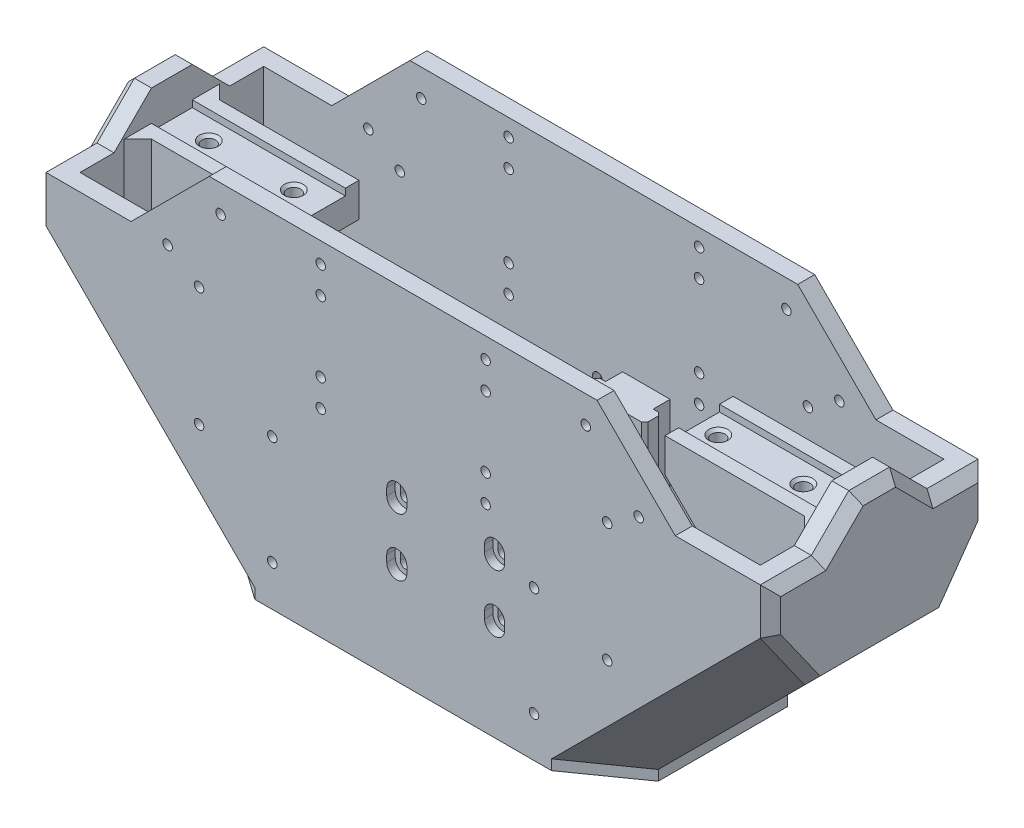
from build123d import *

# Parameters (mm, degrees)
SKETCH1_W                  = 200
SKETCH1_H                  = 54
BOSS_EXTRUDE1_DEPTH        = 70
SHELL1_T                   = 5
BOSS_EXTRUDE2_DEPTH        = 5
BOSS_EXTRUDE3_DEPTH        = 5
SKETCH3_R                  = 1.4
CUT_EXTRUDE1_DEPTH         = 6
BOSS_EXTRUDE4_DEPTH        = 10
SKETCH9_W                  = 45
SKETCH9_H                  = 20
BOSS_EXTRUDE6_DEPTH        = 2
CUT_EXTRUDE2_REACH         = 229.372
SKETCH10_W                 = 12
SKETCH10_H                 = 2
CHAMFER3_SIZE              = 40
CHAMFER5_SIZE              = 43
CHAMFER11_SIZE             = 10
CHAMFER12_SIZE             = 13
CHAMFER13_SIZE             = 4
BOSS_EXTRUDE10_DEPTH       = 3
CHAMFER14_SIZE             = 3
CHAMFER14_OF_MIRROR28_SIZE = 3
SKETCH17_W                 = 14
SKETCH17_H                 = 5
BOSS_EXTRUDE11_DEPTH       = 45
SKETCH20_W                 = 19
SKETCH20_H                 = 5
BOSS_EXTRUDE14_DEPTH       = 8
CUT_EXTRUDE4_DEPTH         = 2.5
CUT_EXTRUDE5_REACH         = 157.226
CUT_EXTRUDE6_REACH         = 189.609
SKETCH24_W                 = 15
SKETCH24_H                 = 8
CHAMFER18_SIZE             = 4
CHAMFER19_SIZE             = 1
CHAMFER20_SIZE             = 2
BOSS_EXTRUDE15_DEPTH       = 3
CUT_EXTRUDE7_REACH         = 148.072
SKETCH27_W                 = 60
SKETCH27_H                 = 24
CHAMFER21_SIZE             = 5
SKETCH28_R                 = 2.75
CUT_EXTRUDE8_DEPTH         = 7
SKETCH29_R                 = 2.75
CUT_EXTRUDE9_DEPTH         = 7
MIRROR33_COPY_1_SKETCH_R   = 2.75
MIRROR33_COPY_1_DEPTH      = 7
SKETCH32_R                 = 1.9
CUT_EXTRUDE11_DEPTH        = 2
MIRROR35_COPY_1_SKETCH_R   = 1.9
MIRROR35_COPY_1_DEPTH      = 2
SKETCH33_R                 = 2
CUT_EXTRUDE12_DEPTH        = 5.2
SKETCH34_R                 = 2
CUT_EXTRUDE13_DEPTH        = 5.2
SKETCH35_R                 = 1.4
CUT_EXTRUDE14_DEPTH        = 6
LPATTERN1_COUNT            = 2
LPATTERN1_PITCH            = 8
CUT_EXTRUDE15_REACH        = 158.234
SKETCH36_R                 = 1.4
LPATTERN2_COUNT            = 2
LPATTERN2_PITCH            = 8
CUT_EXTRUDE16_REACH        = 158.234
SKETCH39_R                 = 1.4
CUT_EXTRUDE17_REACH        = 158.234
SKETCH40_R                 = 1.4
CUT_EXTRUDE18_REACH        = 158.234
SKETCH41_R                 = 1.4
MIRROR38_COPY_1_REACH      = 158.234
MIRROR38_COPY_1_SKETCH_R   = 1.4
CUT_EXTRUDE19_REACH        = 194.48
SKETCH43_R                 = 1.4
CHAMFER22_SIZE             = 0.8
CHAMFER23_SIZE             = 1


# Some blends are built 0.0001 mm under size
with BuildPart() as part:
    # Sketch1 → Boss-Extrude1 (new body)
    with BuildSketch(Plane(origin=(0, 0, 0), x_dir=(1, 0, 0), z_dir=(0, 1, 0))):
        Rectangle(SKETCH1_W, SKETCH1_H)
    extrude(amount=BOSS_EXTRUDE1_DEPTH)

    # Shell1
    shell1_openings = [part.faces().sort_by_distance(p)[0] for p in [
        (0, 70, 0),
    ]]
    offset(amount=SHELL1_T, openings=shell1_openings, kind=Kind.INTERSECTION)

    # Sketch2 → Boss-Extrude2 (add)
    with BuildSketch(Plane(origin=(105, 0, 0), x_dir=(0, 0, -1), z_dir=(1, 0, 0))):
        Polygon((-17, 70), (-6, 81), (6, 81), (17, 70), align=None)
    boss_extrude2 = extrude(amount=-BOSS_EXTRUDE2_DEPTH)

    # Sketch4 → Boss-Extrude3 (add)
    with BuildSketch(Plane(origin=(0, 0, -32), x_dir=(-1, 0, 0), z_dir=(0, 0, -1))):
        Polygon((-80, 70), (-57, 93), (57, 93), (80, 70), align=None)
    boss_extrude3 = extrude(amount=-BOSS_EXTRUDE3_DEPTH)

    # Sketch3 → Cut-Extrude1 (cut)
    with BuildSketch(Plane(origin=(0, 0, -32), x_dir=(-1, 0, 0), z_dir=(0, 0, -1))):
        with Locations((-28, 88)):
            Circle(SKETCH3_R)
        with Locations((-28, 56)):
            Circle(SKETCH3_R)
        with Locations((28, 88)):
            Circle(SKETCH3_R)
        with Locations((28, 56)):
            Circle(SKETCH3_R)
    cut_extrude1 = extrude(amount=-CUT_EXTRUDE1_DEPTH, mode=Mode.SUBTRACT)

    # Mirror4: Boss-Extrude3 across plane
    add(boss_extrude3.mirror(Plane.XY))

    # Mirror5: Boss-Extrude2 across plane
    add(boss_extrude2.mirror(Plane(origin=(0, 0, 0), x_dir=(0, 0, 1), z_dir=(1, 0, 0))))

    # Sketch5 → Boss-Extrude4 (add, symmetric)
    with BuildSketch(Plane.XY):
        Polygon((-100, 70), (-55, 70), (-55, 62), (-100, 17), align=None)
    boss_extrude4 = extrude(amount=BOSS_EXTRUDE4_DEPTH, both=True)

    # Sketch9 → Boss-Extrude6 (add)
    with BuildSketch(Plane(origin=(0, 70, 0), x_dir=(1, 0, 0), z_dir=(0, 1, 0))):
        with Locations((-77.5, 0)):
            Rectangle(SKETCH9_W, SKETCH9_H)
    boss_extrude6 = extrude(amount=BOSS_EXTRUDE6_DEPTH)

    # Sketch10 → Cut-Extrude2 (cut, up to next)
    with BuildSketch(Plane(origin=(-100, 0, 0), x_dir=(0, 0, -1), z_dir=(1, 0, 0)), mode=Mode.PRIVATE) as cut_extrude2_sk1:
        with Locations((0, 71)):
            Rectangle(SKETCH10_W, SKETCH10_H)
    cut_extrude2_tool1 = extrude(cut_extrude2_sk1.sketch, amount=CUT_EXTRUDE2_REACH, mode=Mode.PRIVATE) & part.part
    cut_extrude2 = cut_extrude2_tool1.solids().sort_by_distance((-100, 71, 0))[0]
    add(cut_extrude2, mode=Mode.SUBTRACT)

    # Mirror24: Boss-Extrude4, Boss-Extrude6, Cut-Extrude2 across plane
    add(boss_extrude4.mirror(Plane(origin=(0, 0, 0), x_dir=(0, 0, 1), z_dir=(1, 0, 0))))
    add(boss_extrude6.mirror(Plane(origin=(0, 0, 0), x_dir=(0, 0, 1), z_dir=(1, 0, 0))))
    add(cut_extrude2.mirror(Plane(origin=(0, 0, 0), x_dir=(0, 0, 1), z_dir=(1, 0, 0))), mode=Mode.SUBTRACT)

    # Chamfer3
    # the kernel refuses this chamfer: 40 mm, written as the material it adds along each edge
    with BuildSketch(Plane(origin=(100, 0, 27), x_dir=(0.027495876610586317, 0.9996219169112968, 0), z_dir=(0, 0, -1)), Plane(origin=(-100, 0, -27), x_dir=(-0.027495876610586317, 0.9996219169112968, 0), z_dir=(0, 0, 1))) as chamfer3_piece_1:
        Polygon((CHAMFER3_SIZE * 0.999621916911, -CHAMFER3_SIZE * 0.0274958766106), (-CHAMFER3_SIZE * 0.0274958766106, -CHAMFER3_SIZE * 0.999621916911), (0, 0), align=None)
    extrude(amount=54)

    # Chamfer5
    chamfer5_edges = [part.edges().sort_by_distance(p)[0] for p in [
        (-105, -5, 0),
        (105, -5, 0),
    ]]
    chamfer(chamfer5_edges, length=CHAMFER5_SIZE)

    # Chamfer11
    chamfer11_edges = [part.edges().sort_by_distance(p)[0] for p in [
        (-80, 20, -27),
        (80, 20, -27),
        (-80, 20, 27),
        (80, 20, 27),
    ]]
    chamfer(chamfer11_edges, length=CHAMFER11_SIZE)

    # Chamfer12
    chamfer12_edges = [part.edges().sort_by_distance(p)[0] for p in [
        (-83.5, 16.5, -32),
        (83.5, 16.5, -32),
        (-83.5, 16.5, 32),
        (83.5, 16.5, 32),
    ]]
    chamfer(chamfer12_edges, length=CHAMFER12_SIZE)

    # Chamfer13
    chamfer13_edges = [part.edges().sort_by_distance(p)[0] for p in [
        (-100, 56, -10),
        (-100, 56, 10),
        (100, 56, 10),
        (100, 56, -10),
    ]]
    chamfer(chamfer13_edges, length=CHAMFER13_SIZE)

    # Sketch16 → Boss-Extrude10 (add)
    with BuildSketch(Plane(origin=(105, 0, 0), x_dir=(0, 0, -1), z_dir=(1, 0, 0))):
        Polygon((-19, 38), (19, 38), (32, 56.384776311), (32, 70), (17, 70), (6, 81), (-6, 81), (-17, 70), (-32, 70), (-32, 56.384776311), align=None)
    boss_extrude10 = extrude(amount=BOSS_EXTRUDE10_DEPTH)

    # Chamfer14
    chamfer14_edges = [part.edges().sort_by_distance(p)[0] for p in [
        (108, 63.192388155, 32),
        (108, 70, 24.5),
        (108, 75.5, 11.5),
        (108, 81, 0),
        (108, 75.5, -11.5),
        (108, 70, -24.5),
        (108, 63.192388155, -32),
        (108, 47.192388155, -25.5),
        (108, 38, 0),
        (108, 47.192388155, 25.5),
    ]]
    chamfer(chamfer14_edges, length=CHAMFER14_SIZE - 0.0001)  # a hair under: the kernel refuses the full size

    # Mirror28: Boss-Extrude10 across plane
    add(boss_extrude10.mirror(Plane(origin=(0, 0, 0), x_dir=(0, 0, 1), z_dir=(1, 0, 0))))

    # Chamfer14 of Mirror28
    chamfer14_of_mirror28_edges = [part.edges().sort_by_distance(p)[0] for p in [
        (-108, 63.192388155, 32),
        (-108, 70, 24.5),
        (-108, 75.5, 11.5),
        (-108, 81, 0),
        (-108, 75.5, -11.5),
        (-108, 70, -24.5),
        (-108, 63.192388155, -32),
        (-108, 47.192388155, -25.5),
        (-108, 38, 0),
        (-108, 47.192388155, 25.5),
    ]]
    chamfer(chamfer14_of_mirror28_edges, length=CHAMFER14_OF_MIRROR28_SIZE - 0.0001)  # a hair under: the kernel refuses the full size

    # Sketch17 → Boss-Extrude11 (add)
    with BuildSketch(Plane(origin=(0, 0, 0), x_dir=(1, 0, 0), z_dir=(0, 1, 0))):
        Polygon((3, -22), (5.5, -22), (19.5, -22), (22, -22), (22, -17), (3, -17), align=None)
        with Locations((12.5, -24.5)):
            Rectangle(SKETCH17_W, SKETCH17_H)
    boss_extrude11 = extrude(amount=BOSS_EXTRUDE11_DEPTH)

    # Sketch20 → Boss-Extrude14 (add)
    with BuildSketch(Plane(origin=(0, 0, 0), x_dir=(1, 0, 0), z_dir=(0, 1, 0))):
        with Locations((12.5, -14.5)):
            Rectangle(SKETCH20_W, SKETCH20_H)
    boss_extrude14 = extrude(amount=BOSS_EXTRUDE14_DEPTH)

    # Mirror29: Boss-Extrude11, Boss-Extrude14 across plane
    add(boss_extrude11.mirror(Plane.XY))
    add(boss_extrude14.mirror(Plane.XY))

    # Sketch22 → Cut-Extrude4 (cut)
    with BuildSketch(Plane.XY.offset(-27)):
        with BuildLine():
            Line((-3.325, 37.8), (-3.325, 39.8))
            ThreePointArc((-3.325, 39.8), (-1.875, 41.25), (-0.425, 39.8))
            Line((-0.425, 39.8), (-0.425, 37.8))
            ThreePointArc((-0.425, 37.8), (-1.875, 36.35), (-3.325, 37.8))
        make_face()
        with BuildLine():
            Line((28.325, 37.8), (28.325, 39.8))
            ThreePointArc((28.325, 39.8), (26.875, 41.25), (25.425, 39.8))
            Line((25.425, 39.8), (25.425, 37.8))
            ThreePointArc((25.425, 37.8), (26.875, 36.35), (28.325, 37.8))
        make_face()
        with BuildLine():
            Line((-3.325, 22.8), (-3.325, 20.8))
            ThreePointArc((-3.325, 20.8), (-1.875, 19.35), (-0.425, 20.8))
            Line((-0.425, 20.8), (-0.425, 22.8))
            ThreePointArc((-0.425, 22.8), (-1.875, 24.25), (-3.325, 22.8))
        make_face()
        with BuildLine():
            Line((28.325, 22.8), (28.325, 20.8))
            ThreePointArc((28.325, 20.8), (26.875, 19.35), (25.425, 20.8))
            Line((25.425, 20.8), (25.425, 22.8))
            ThreePointArc((25.425, 22.8), (26.875, 24.25), (28.325, 22.8))
        make_face()
    cut_extrude4 = extrude(amount=-CUT_EXTRUDE4_DEPTH, mode=Mode.SUBTRACT)

    # Sketch23 → Cut-Extrude5 (cut, up to next)
    with BuildSketch(Plane.XY.offset(-29.5), mode=Mode.PRIVATE) as cut_extrude5_sk1:
        with BuildLine():
            Line((29.825, 37.8), (29.825, 39.8))
            ThreePointArc((29.825, 39.8), (26.875, 42.75), (23.925, 39.8))
            Line((23.925, 39.8), (23.925, 37.8))
            ThreePointArc((23.925, 37.8), (26.875, 34.85), (29.825, 37.8))
        make_face()
    cut_extrude5_tool1 = extrude(cut_extrude5_sk1.sketch, amount=-CUT_EXTRUDE5_REACH, mode=Mode.PRIVATE) & part.part
    # Sketch23 → Cut-Extrude5 (cut, up to next)
    with BuildSketch(Plane.XY.offset(-29.5), mode=Mode.PRIVATE) as cut_extrude5_sk2:
        with BuildLine():
            Line((1.075, 37.8), (1.075, 39.8))
            ThreePointArc((1.075, 39.8), (-1.875, 42.75), (-4.825, 39.8))
            Line((-4.825, 39.8), (-4.825, 37.8))
            ThreePointArc((-4.825, 37.8), (-1.875, 34.85), (1.075, 37.8))
        make_face()
    cut_extrude5_tool2 = extrude(cut_extrude5_sk2.sketch, amount=-CUT_EXTRUDE5_REACH, mode=Mode.PRIVATE) & part.part
    # Sketch23 → Cut-Extrude5 (cut, up to next)
    with BuildSketch(Plane.XY.offset(-29.5), mode=Mode.PRIVATE) as cut_extrude5_sk3:
        with BuildLine():
            Line((-4.825, 22.8), (-4.825, 20.8))
            ThreePointArc((-4.825, 20.8), (-1.875, 17.85), (1.075, 20.8))
            Line((1.075, 20.8), (1.075, 22.8))
            ThreePointArc((1.075, 22.8), (-1.875, 25.75), (-4.825, 22.8))
        make_face()
    cut_extrude5_tool3 = extrude(cut_extrude5_sk3.sketch, amount=-CUT_EXTRUDE5_REACH, mode=Mode.PRIVATE) & part.part
    # Sketch23 → Cut-Extrude5 (cut, up to next)
    with BuildSketch(Plane.XY.offset(-29.5), mode=Mode.PRIVATE) as cut_extrude5_sk4:
        with BuildLine():
            Line((23.925, 22.8), (23.925, 20.8))
            ThreePointArc((23.925, 20.8), (26.875, 17.85), (29.825, 20.8))
            Line((29.825, 20.8), (29.825, 22.8))
            ThreePointArc((29.825, 22.8), (26.875, 25.75), (23.925, 22.8))
        make_face()
    cut_extrude5_tool4 = extrude(cut_extrude5_sk4.sketch, amount=-CUT_EXTRUDE5_REACH, mode=Mode.PRIVATE) & part.part
    cut_extrude5_1 = cut_extrude5_tool1.solids().sort_by_distance((26.875, 38.8, -29.5))[0]
    add(cut_extrude5_1, mode=Mode.SUBTRACT)
    cut_extrude5_2 = cut_extrude5_tool2.solids().sort_by_distance((-1.875, 38.8, -29.5))[0]
    add(cut_extrude5_2, mode=Mode.SUBTRACT)
    cut_extrude5_3 = cut_extrude5_tool3.solids().sort_by_distance((-1.875, 21.8, -29.5))[0]
    add(cut_extrude5_3, mode=Mode.SUBTRACT)
    cut_extrude5_4 = cut_extrude5_tool4.solids().sort_by_distance((26.875, 21.8, -29.5))[0]
    add(cut_extrude5_4, mode=Mode.SUBTRACT)
    cut_extrude5 = cut_extrude5_1 + cut_extrude5_2 + cut_extrude5_3 + cut_extrude5_4  # Cut-Extrude5 as one shape, for the pattern or mirror that repeats it

    # Mirror30: Cut-Extrude4, Cut-Extrude5 across plane
    add(cut_extrude4.mirror(Plane.XY), mode=Mode.SUBTRACT)
    add(cut_extrude5.mirror(Plane.XY), mode=Mode.SUBTRACT)

    # Sketch24 → Cut-Extrude6 (cut, up to next)
    with BuildSketch(Plane(origin=(30, -30, 0), x_dir=(0, 0, 1), z_dir=(-0.707106781186544, 0.7071067811865511, 0)), mode=Mode.PRIVATE) as cut_extrude6_sk1:
        with Locations((0, 51.426406871)):
            Rectangle(SKETCH24_W, SKETCH24_H)
    cut_extrude6_tool1 = extrude(cut_extrude6_sk1.sketch, amount=-CUT_EXTRUDE6_REACH, mode=Mode.PRIVATE) & part.part
    add(cut_extrude6_tool1.solids().sort_by_distance((66.363961, 6.363961, 0))[0], mode=Mode.SUBTRACT)

    # Chamfer18
    chamfer18_edges = [part.edges().sort_by_distance(p)[0] for p in [
        (22, 0, 17),
        (3, 0, 17),
        (3, 0, -17),
        (22, 0, -17),
    ]]
    chamfer(chamfer18_edges, length=CHAMFER18_SIZE)

    # Chamfer19
    chamfer19_edges = [part.edges().sort_by_distance(p)[0] for p in [
        (3, 24.5, 22),
        (22, 24.5, 22),
        (22, 26.5, 17),
        (3, 26.5, 17),
        (3, 24.5, -22),
        (3, 26.5, -17),
        (22, 26.5, -17),
        (22, 24.5, -22),
    ]]
    chamfer(chamfer19_edges, length=CHAMFER19_SIZE)

    # Chamfer20
    chamfer20_edges = [part.edges().sort_by_distance(p)[0] for p in [
        (70.942388155, 7.442388155, 7.5),
        (65.285533906, 1.785533906, 7.5),
        (65.285533906, 1.785533906, -7.5),
        (70.942388155, 7.442388155, -7.5),
    ]]
    chamfer(chamfer20_edges, length=CHAMFER20_SIZE)

    # Sketch25 → Boss-Extrude15 (add)
    with BuildSketch(Plane.XZ.offset(5)):
        Polygon((-43.615223689, -32), (43.615223689, -32), (62, -19), (62, 19), (43.615223689, 32), (-43.615223689, 32), (-62, 19), (-62, -19), align=None)
    extrude(amount=BOSS_EXTRUDE15_DEPTH)

    # Sketch27 → Cut-Extrude7 (cut, up to next)
    with BuildSketch(Plane(origin=(0, 0, 0), x_dir=(1, 0, 0), z_dir=(0, 1, 0)), mode=Mode.PRIVATE) as cut_extrude7_sk1:
        Rectangle(SKETCH27_W, SKETCH27_H)
    cut_extrude7_tool1 = extrude(cut_extrude7_sk1.sketch, amount=-CUT_EXTRUDE7_REACH, mode=Mode.PRIVATE) & part.part
    add(cut_extrude7_tool1.solids().sort_by_distance((0, 0, 0))[0], mode=Mode.SUBTRACT)

    # Chamfer21
    chamfer21_edges = [part.edges().sort_by_distance(p)[0] for p in [
        (-30, -4, 12),
        (-30, -4, -12),
        (30, -4, -12),
        (30, -4, 12),
    ]]
    chamfer(chamfer21_edges, length=CHAMFER21_SIZE)

    # Sketch28 → Cut-Extrude8 (cut)
    with BuildSketch(Plane.XZ.offset(8)):
        with Locations(Location((-52.807611845, 0, 0), (0, 0, 270))):
            Circle(SKETCH28_R)
        with Locations(Location((-52.807611845, 15, 0), (0, 0, 270))):
            Circle(SKETCH28_R)
        with Locations(Location((-52.807611845, -15, 0), (0, 0, 270))):
            Circle(SKETCH28_R)
    cut_extrude8 = extrude(amount=-CUT_EXTRUDE8_DEPTH, mode=Mode.SUBTRACT)

    # Mirror31: Cut-Extrude8 across plane
    add(cut_extrude8.mirror(Plane(origin=(0, 0, 0), x_dir=(0, 0, 1), z_dir=(1, 0, 0))), mode=Mode.SUBTRACT)

    # Sketch29 → Cut-Extrude9 (cut)
    with BuildSketch(Plane.XZ.offset(8)):
        with Locations(Location((0, 24, 0), (0, 0, 270))):
            Circle(SKETCH29_R)
        with Locations(Location((20, 24, 0), (0, 0, 270))):
            Circle(SKETCH29_R)
        with Locations(Location((40, 24, 0), (0, 0, 270))):
            Circle(SKETCH29_R)
    cut_extrude9 = extrude(amount=-CUT_EXTRUDE9_DEPTH, mode=Mode.SUBTRACT)

    # Mirror32: Cut-Extrude9 across plane
    add(cut_extrude9.mirror(Plane(origin=(0, 0, 0), x_dir=(0, 0, 1), z_dir=(1, 0, 0))), mode=Mode.SUBTRACT)

    # Mirror33: Cut-Extrude9 across plane
    add(cut_extrude9.mirror(Plane.XY), mode=Mode.SUBTRACT)

    # Mirror33 copy 1 sketch → Mirror33 copy 1 (cut)
    with BuildSketch(Plane(origin=(0, -8, 0), x_dir=(-1, 0, 0), z_dir=(0, -1, 0))):
        with Locations(Location((0, 24, 0), (0, 0, 270))):
            Circle(MIRROR33_COPY_1_SKETCH_R)
        with Locations(Location((20, 24, 0), (0, 0, 270))):
            Circle(MIRROR33_COPY_1_SKETCH_R)
        with Locations(Location((40, 24, 0), (0, 0, 270))):
            Circle(MIRROR33_COPY_1_SKETCH_R)
    extrude(amount=-MIRROR33_COPY_1_DEPTH, mode=Mode.SUBTRACT)

    # Sketch32 → Cut-Extrude11 (cut)
    with BuildSketch(Plane.XZ.offset(1)):
        with Locations(Location((-40, 24, 0), (0, 0, 270))):
            Circle(SKETCH32_R)
        with Locations(Location((-52.807611845, 15, 0), (0, 0, 270))):
            Circle(SKETCH32_R)
        with Locations(Location((-52.807611845, 0, 0), (0, 0, 270))):
            Circle(SKETCH32_R)
    cut_extrude11 = extrude(amount=-CUT_EXTRUDE11_DEPTH, mode=Mode.SUBTRACT)

    # Mirror34: Cut-Extrude11 across plane
    add(cut_extrude11.mirror(Plane.XY), mode=Mode.SUBTRACT)

    # Mirror35: Cut-Extrude11 across plane
    add(cut_extrude11.mirror(Plane(origin=(0, 0, 0), x_dir=(0, 0, 1), z_dir=(1, 0, 0))), mode=Mode.SUBTRACT)

    # Mirror35 copy 1 sketch → Mirror35 copy 1 (cut)
    with BuildSketch(Plane(origin=(0, -1, 0), x_dir=(-1, 0, 0), z_dir=(0, -1, 0))):
        with Locations(Location((-40, 24, 0), (0, 0, 270))):
            Circle(MIRROR35_COPY_1_SKETCH_R)
        with Locations(Location((-52.807611845, 15, 0), (0, 0, 270))):
            Circle(MIRROR35_COPY_1_SKETCH_R)
        with Locations(Location((-52.807611845, 0, 0), (0, 0, 270))):
            Circle(MIRROR35_COPY_1_SKETCH_R)
    extrude(amount=-MIRROR35_COPY_1_DEPTH, mode=Mode.SUBTRACT)

    # Sketch33 → Cut-Extrude12 (cut)
    with BuildSketch(Plane(origin=(0, 70, 0), x_dir=(1, 0, 0), z_dir=(0, 1, 0))):
        with Locations(Location((-89.15, 0, 0), (0, 0, 270))):
            Circle(SKETCH33_R)
        with Locations(Location((-64.15, 0, 0), (0, 0, 270))):
            Circle(SKETCH33_R)
    extrude(amount=-CUT_EXTRUDE12_DEPTH, mode=Mode.SUBTRACT)

    # Sketch34 → Cut-Extrude13 (cut)
    with BuildSketch(Plane(origin=(0, 70, 0), x_dir=(1, 0, 0), z_dir=(0, 1, 0))):
        with Locations(Location((85.65, 0, 0), (0, 0, 270))):
            Circle(SKETCH34_R)
        with Locations(Location((60.65, 0, 0), (0, 0, 270))):
            Circle(SKETCH34_R)
    extrude(amount=-CUT_EXTRUDE13_DEPTH, mode=Mode.SUBTRACT)

    # Sketch35 → Cut-Extrude14 (cut)
    with BuildSketch(Plane(origin=(0, 64.8, 0), x_dir=(1, 0, 0), z_dir=(0, 1, 0))):
        with Locations(Location((-89.15, 0, 0), (0, 0, 270))):
            Circle(SKETCH35_R)
        with Locations(Location((-64.15, 0, 0), (0, 0, 270))):
            Circle(SKETCH35_R)
        with Locations(Location((60.65, 0, 0), (0, 0, 270))):
            Circle(SKETCH35_R)
        with Locations(Location((85.65, 0, 0), (0, 0, 270))):
            Circle(SKETCH35_R)
    extrude(amount=-CUT_EXTRUDE14_DEPTH, mode=Mode.SUBTRACT)

    # LPattern1: Cut-Extrude1 ×2
    with Locations(*[(0, -i * LPATTERN1_PITCH, 0) for i in range(1, LPATTERN1_COUNT)]):
        add(cut_extrude1, mode=Mode.SUBTRACT)

    # Sketch36 → Cut-Extrude15 (cut, up to next)
    with BuildSketch(Plane.XY.offset(32), mode=Mode.PRIVATE) as cut_extrude15_sk1:
        with Locations((-24.25, 87)):
            Circle(SKETCH36_R)
    cut_extrude15_tool1 = extrude(cut_extrude15_sk1.sketch, amount=-CUT_EXTRUDE15_REACH, mode=Mode.PRIVATE) & part.part
    # Sketch36 → Cut-Extrude15 (cut, up to next)
    with BuildSketch(Plane.XY.offset(32), mode=Mode.PRIVATE) as cut_extrude15_sk2:
        with Locations((24.25, 87)):
            Circle(SKETCH36_R)
    cut_extrude15_tool2 = extrude(cut_extrude15_sk2.sketch, amount=-CUT_EXTRUDE15_REACH, mode=Mode.PRIVATE) & part.part
    # Sketch36 → Cut-Extrude15 (cut, up to next)
    with BuildSketch(Plane.XY.offset(32), mode=Mode.PRIVATE) as cut_extrude15_sk3:
        with Locations((24.25, 58.3)):
            Circle(SKETCH36_R)
    cut_extrude15_tool3 = extrude(cut_extrude15_sk3.sketch, amount=-CUT_EXTRUDE15_REACH, mode=Mode.PRIVATE) & part.part
    # Sketch36 → Cut-Extrude15 (cut, up to next)
    with BuildSketch(Plane.XY.offset(32), mode=Mode.PRIVATE) as cut_extrude15_sk4:
        with Locations((-24.25, 58.3)):
            Circle(SKETCH36_R)
    cut_extrude15_tool4 = extrude(cut_extrude15_sk4.sketch, amount=-CUT_EXTRUDE15_REACH, mode=Mode.PRIVATE) & part.part
    cut_extrude15_1 = cut_extrude15_tool1.solids().sort_by_distance((-24.25, 87, 32))[0]
    add(cut_extrude15_1, mode=Mode.SUBTRACT)
    cut_extrude15_2 = cut_extrude15_tool2.solids().sort_by_distance((24.25, 87, 32))[0]
    add(cut_extrude15_2, mode=Mode.SUBTRACT)
    cut_extrude15_3 = cut_extrude15_tool3.solids().sort_by_distance((24.25, 58.3, 32))[0]
    add(cut_extrude15_3, mode=Mode.SUBTRACT)
    cut_extrude15_4 = cut_extrude15_tool4.solids().sort_by_distance((-24.25, 58.3, 32))[0]
    add(cut_extrude15_4, mode=Mode.SUBTRACT)
    cut_extrude15 = cut_extrude15_1 + cut_extrude15_2 + cut_extrude15_3 + cut_extrude15_4  # Cut-Extrude15 as one shape, for the pattern or mirror that repeats it

    # LPattern2: Cut-Extrude15 ×2
    with Locations(*[(0, -i * LPATTERN2_PITCH, 0) for i in range(1, LPATTERN2_COUNT)]):
        add(cut_extrude15, mode=Mode.SUBTRACT)

    # Sketch39 → Cut-Extrude16 (cut, up to next)
    with BuildSketch(Plane(origin=(0, 0, -32), x_dir=(-1, 0, 0), z_dir=(0, 0, -1)), mode=Mode.PRIVATE) as cut_extrude16_sk1:
        with Locations((-38.473088065, 4)):
            Circle(SKETCH39_R)
    cut_extrude16_tool1 = extrude(cut_extrude16_sk1.sketch, amount=-CUT_EXTRUDE16_REACH, mode=Mode.PRIVATE) & part.part
    # Sketch39 → Cut-Extrude16 (cut, up to next)
    with BuildSketch(Plane(origin=(0, 0, -32), x_dir=(-1, 0, 0), z_dir=(0, 0, -1)), mode=Mode.PRIVATE) as cut_extrude16_sk2:
        with Locations((38.473088065, 4)):
            Circle(SKETCH39_R)
    cut_extrude16_tool2 = extrude(cut_extrude16_sk2.sketch, amount=-CUT_EXTRUDE16_REACH, mode=Mode.PRIVATE) & part.part
    # Sketch39 → Cut-Extrude16 (cut, up to next)
    with BuildSketch(Plane(origin=(0, 0, -32), x_dir=(-1, 0, 0), z_dir=(0, 0, -1)), mode=Mode.PRIVATE) as cut_extrude16_sk3:
        with Locations((38.473088065, 36)):
            Circle(SKETCH39_R)
    cut_extrude16_tool3 = extrude(cut_extrude16_sk3.sketch, amount=-CUT_EXTRUDE16_REACH, mode=Mode.PRIVATE) & part.part
    # Sketch39 → Cut-Extrude16 (cut, up to next)
    with BuildSketch(Plane(origin=(0, 0, -32), x_dir=(-1, 0, 0), z_dir=(0, 0, -1)), mode=Mode.PRIVATE) as cut_extrude16_sk4:
        with Locations((-38.473088065, 36)):
            Circle(SKETCH39_R)
    cut_extrude16_tool4 = extrude(cut_extrude16_sk4.sketch, amount=-CUT_EXTRUDE16_REACH, mode=Mode.PRIVATE) & part.part
    cut_extrude16_1 = cut_extrude16_tool1.solids().sort_by_distance((38.473088, 4, -32))[0]
    add(cut_extrude16_1, mode=Mode.SUBTRACT)
    cut_extrude16_2 = cut_extrude16_tool2.solids().sort_by_distance((-38.473088, 4, -32))[0]
    add(cut_extrude16_2, mode=Mode.SUBTRACT)
    cut_extrude16_3 = cut_extrude16_tool3.solids().sort_by_distance((-38.473088, 36, -32))[0]
    add(cut_extrude16_3, mode=Mode.SUBTRACT)
    cut_extrude16_4 = cut_extrude16_tool4.solids().sort_by_distance((38.473088, 36, -32))[0]
    add(cut_extrude16_4, mode=Mode.SUBTRACT)
    cut_extrude16 = cut_extrude16_1 + cut_extrude16_2 + cut_extrude16_3 + cut_extrude16_4  # Cut-Extrude16 as one shape, for the pattern or mirror that repeats it

    # Sketch40 → Cut-Extrude17 (cut, up to next)
    with BuildSketch(Plane(origin=(0, 0, -32), x_dir=(-1, 0, 0), z_dir=(0, 0, -1)), mode=Mode.PRIVATE) as cut_extrude17_sk1:
        with Locations((-60, 63.355339059)):
            Circle(SKETCH40_R)
    cut_extrude17_tool1 = extrude(cut_extrude17_sk1.sketch, amount=-CUT_EXTRUDE17_REACH, mode=Mode.PRIVATE) & part.part
    # Sketch40 → Cut-Extrude17 (cut, up to next)
    with BuildSketch(Plane(origin=(0, 0, -32), x_dir=(-1, 0, 0), z_dir=(0, 0, -1)), mode=Mode.PRIVATE) as cut_extrude17_sk2:
        with Locations((60, 63.355339059)):
            Circle(SKETCH40_R)
    cut_extrude17_tool2 = extrude(cut_extrude17_sk2.sketch, amount=-CUT_EXTRUDE17_REACH, mode=Mode.PRIVATE) & part.part
    # Sketch40 → Cut-Extrude17 (cut, up to next)
    with BuildSketch(Plane(origin=(0, 0, -32), x_dir=(-1, 0, 0), z_dir=(0, 0, -1)), mode=Mode.PRIVATE) as cut_extrude17_sk3:
        with Locations((60, 28.355339059)):
            Circle(SKETCH40_R)
    cut_extrude17_tool3 = extrude(cut_extrude17_sk3.sketch, amount=-CUT_EXTRUDE17_REACH, mode=Mode.PRIVATE) & part.part
    # Sketch40 → Cut-Extrude17 (cut, up to next)
    with BuildSketch(Plane(origin=(0, 0, -32), x_dir=(-1, 0, 0), z_dir=(0, 0, -1)), mode=Mode.PRIVATE) as cut_extrude17_sk4:
        with Locations((-60, 28.355339059)):
            Circle(SKETCH40_R)
    cut_extrude17_tool4 = extrude(cut_extrude17_sk4.sketch, amount=-CUT_EXTRUDE17_REACH, mode=Mode.PRIVATE) & part.part
    cut_extrude17_1 = cut_extrude17_tool1.solids().sort_by_distance((60, 63.355339, -32))[0]
    add(cut_extrude17_1, mode=Mode.SUBTRACT)
    cut_extrude17_2 = cut_extrude17_tool2.solids().sort_by_distance((-60, 63.355339, -32))[0]
    add(cut_extrude17_2, mode=Mode.SUBTRACT)
    cut_extrude17_3 = cut_extrude17_tool3.solids().sort_by_distance((-60, 28.355339, -32))[0]
    add(cut_extrude17_3, mode=Mode.SUBTRACT)
    cut_extrude17_4 = cut_extrude17_tool4.solids().sort_by_distance((60, 28.355339, -32))[0]
    add(cut_extrude17_4, mode=Mode.SUBTRACT)
    cut_extrude17 = cut_extrude17_1 + cut_extrude17_2 + cut_extrude17_3 + cut_extrude17_4  # Cut-Extrude17 as one shape, for the pattern or mirror that repeats it

    # Mirror36: Cut-Extrude16, Cut-Extrude17 across plane
    add(cut_extrude16.mirror(Plane.XY), mode=Mode.SUBTRACT)
    add(cut_extrude17.mirror(Plane.XY), mode=Mode.SUBTRACT)

    # Sketch41 → Cut-Extrude18 (cut, up to next)
    with BuildSketch(Plane(origin=(0, 0, -32), x_dir=(-1, 0, 0), z_dir=(0, 0, -1)), mode=Mode.PRIVATE) as cut_extrude18_sk1:
        with Locations((-69.242640687, 69.443650814)):
            Circle(SKETCH41_R)
    cut_extrude18_tool1 = extrude(cut_extrude18_sk1.sketch, amount=-CUT_EXTRUDE18_REACH, mode=Mode.PRIVATE) & part.part
    # Sketch41 → Cut-Extrude18 (cut, up to next)
    with BuildSketch(Plane(origin=(0, 0, -32), x_dir=(-1, 0, 0), z_dir=(0, 0, -1)), mode=Mode.PRIVATE) as cut_extrude18_sk2:
        with Locations((-53.686291501, 85)):
            Circle(SKETCH41_R)
    cut_extrude18_tool2 = extrude(cut_extrude18_sk2.sketch, amount=-CUT_EXTRUDE18_REACH, mode=Mode.PRIVATE) & part.part
    cut_extrude18_1 = cut_extrude18_tool1.solids().sort_by_distance((69.242641, 69.443651, -32))[0]
    add(cut_extrude18_1, mode=Mode.SUBTRACT)
    cut_extrude18_2 = cut_extrude18_tool2.solids().sort_by_distance((53.686292, 85, -32))[0]
    add(cut_extrude18_2, mode=Mode.SUBTRACT)
    cut_extrude18 = cut_extrude18_1 + cut_extrude18_2  # Cut-Extrude18 as one shape, for the pattern or mirror that repeats it

    # Mirror37: Cut-Extrude18 across plane
    add(cut_extrude18.mirror(Plane(origin=(0, 0, 0), x_dir=(0, 0, 1), z_dir=(1, 0, 0))), mode=Mode.SUBTRACT)

    # Mirror38: Cut-Extrude18 across plane
    add(cut_extrude18.mirror(Plane.XY), mode=Mode.SUBTRACT)

    # Mirror38 copy 1 sketch → Mirror38 copy 1 (cut, up to next)
    with BuildSketch(Plane.XY.offset(32), mode=Mode.PRIVATE) as mirror38_copy_1_sk1:
        with Locations((-69.242640687, 69.443650814)):
            Circle(MIRROR38_COPY_1_SKETCH_R)
    mirror38_copy_1_tool1 = extrude(mirror38_copy_1_sk1.sketch, amount=-MIRROR38_COPY_1_REACH, mode=Mode.PRIVATE) & part.part
    # Mirror38 copy 1 sketch → Mirror38 copy 1 (cut, up to next)
    with BuildSketch(Plane.XY.offset(32), mode=Mode.PRIVATE) as mirror38_copy_1_sk2:
        with Locations((-53.686291501, 85)):
            Circle(MIRROR38_COPY_1_SKETCH_R)
    mirror38_copy_1_tool2 = extrude(mirror38_copy_1_sk2.sketch, amount=-MIRROR38_COPY_1_REACH, mode=Mode.PRIVATE) & part.part
    add(mirror38_copy_1_tool1.solids().sort_by_distance((-69.242641, 69.443651, 32))[0], mode=Mode.SUBTRACT)
    add(mirror38_copy_1_tool2.solids().sort_by_distance((-53.686292, 85, 32))[0], mode=Mode.SUBTRACT)

    # Sketch43 → Cut-Extrude19 (cut, up to next)
    with BuildSketch(Plane(origin=(-33.5, -33.5, 0), x_dir=(0, 0, 1), z_dir=(-0.7071067811865461, -0.7071067811865489, 0)), mode=Mode.PRIVATE) as cut_extrude19_sk1:
        with Locations(Location((-12, 91.710678119, 0), (0, 0, 270))):
            Circle(SKETCH43_R)
    cut_extrude19_tool1 = extrude(cut_extrude19_sk1.sketch, amount=-CUT_EXTRUDE19_REACH, mode=Mode.PRIVATE) & part.part
    # Sketch43 → Cut-Extrude19 (cut, up to next)
    with BuildSketch(Plane(origin=(-33.5, -33.5, 0), x_dir=(0, 0, 1), z_dir=(-0.7071067811865461, -0.7071067811865489, 0)), mode=Mode.PRIVATE) as cut_extrude19_sk2:
        with Locations(Location((12, 91.710678119, 0), (0, 0, 270))):
            Circle(SKETCH43_R)
    cut_extrude19_tool2 = extrude(cut_extrude19_sk2.sketch, amount=-CUT_EXTRUDE19_REACH, mode=Mode.PRIVATE) & part.part
    # Sketch43 → Cut-Extrude19 (cut, up to next)
    with BuildSketch(Plane(origin=(-33.5, -33.5, 0), x_dir=(0, 0, 1), z_dir=(-0.7071067811865461, -0.7071067811865489, 0)), mode=Mode.PRIVATE) as cut_extrude19_sk3:
        with Locations(Location((12, 49.710678119, 0), (0, 0, 270))):
            Circle(SKETCH43_R)
    cut_extrude19_tool3 = extrude(cut_extrude19_sk3.sketch, amount=-CUT_EXTRUDE19_REACH, mode=Mode.PRIVATE) & part.part
    # Sketch43 → Cut-Extrude19 (cut, up to next)
    with BuildSketch(Plane(origin=(-33.5, -33.5, 0), x_dir=(0, 0, 1), z_dir=(-0.7071067811865461, -0.7071067811865489, 0)), mode=Mode.PRIVATE) as cut_extrude19_sk4:
        with Locations(Location((-12, 49.710678119, 0), (0, 0, 270))):
            Circle(SKETCH43_R)
    cut_extrude19_tool4 = extrude(cut_extrude19_sk4.sketch, amount=-CUT_EXTRUDE19_REACH, mode=Mode.PRIVATE) & part.part
    add(cut_extrude19_tool1.solids().sort_by_distance((-98.349242, 31.349242, -12))[0], mode=Mode.SUBTRACT)
    add(cut_extrude19_tool2.solids().sort_by_distance((-98.349242, 31.349242, 12))[0], mode=Mode.SUBTRACT)
    add(cut_extrude19_tool3.solids().sort_by_distance((-68.650758, 1.650758, 12))[0], mode=Mode.SUBTRACT)
    add(cut_extrude19_tool4.solids().sort_by_distance((-68.650758, 1.650758, -12))[0], mode=Mode.SUBTRACT)

    # Chamfer22
    chamfer22_edges = [part.edges().sort_by_distance(p)[0] for p in [
        (-89.15, 70, -2),
        (-64.15, 70, -2),
        (85.65, 70, -2),
        (60.65, 70, -2),
    ]]
    chamfer(chamfer22_edges, length=CHAMFER22_SIZE)

    # Chamfer23
    chamfer23_edges = [part.edges().sort_by_distance(p)[0] for p in [
        (-52.807611845, -8, 17.75),
        (-52.807611845, -8, -12.25),
        (-52.807611845, -8, 2.75),
        (52.807611845, -8, 17.75),
        (52.807611845, -8, -12.25),
        (52.807611845, -8, 2.75),
        (0, -8, 26.75),
        (20, -8, 26.75),
        (40, -8, 26.75),
        (-20, -8, 26.75),
        (-40, -8, 26.75),
        (0, -8, -26.75),
        (-20, -8, -26.75),
        (-40, -8, -26.75),
        (20, -8, -26.75),
        (40, -8, -26.75),
    ]]
    chamfer(chamfer23_edges, length=CHAMFER23_SIZE)


solid = part.part
